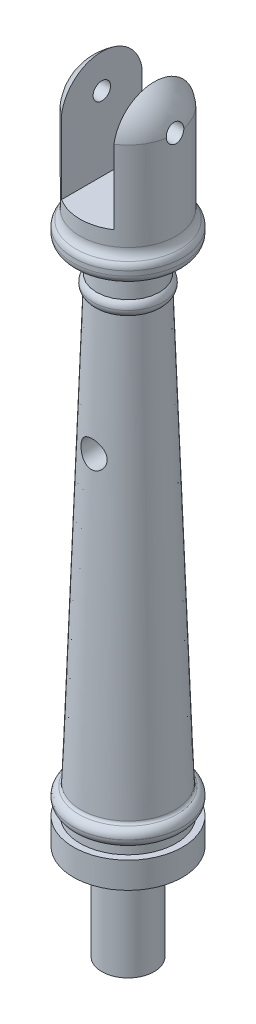
from build123d import *

# Parameters (mm, degrees)
SKETCH3_R               = 12.5
BOSS_EXTRUDE1_DEPTH     = 6
BOSS_EXTRUDE3_START     = -12
SKETCH5_R               = 12.5
BOSS_EXTRUDE3_DEPTH     = 4
FILLET1_R               = 2
SKETCH6_R               = 6
BOSS_EXTRUDE4_DEPTH     = 22
CUT_EXTRUDE1_START      = -15
CUT_EXTRUDE1_DEPTH      = 15
BOSS_EXTRUDE5_START     = -8
SKETCH8_R               = 8
BOSS_EXTRUDE5_DEPTH     = 2
FILLET2_R               = 2
BOSS_EXTRUDE6_START     = 5
SKETCH9_R               = 12.5
BOSS_EXTRUDE6_DEPTH     = 5
SKETCH10_R              = 11
BOSS_EXTRUDE7_DEPTH     = 22
FILLET3_R               = 2
FILLET4_R               = 3
FILLET5_R               = 0.75
CUT_EXTRUDE2_DEPTH      = 152.535125655
CUT_EXTRUDE2_DEPTH_BACK = 152.535125655
SKETCH12_W              = 12
SKETCH12_H              = 28
CUT_EXTRUDE3_DEPTH      = 150.832528731
CUT_EXTRUDE3_DEPTH_BACK = 150.832528731
SKETCH13_R              = 3
CUT_EXTRUDE4_DEPTH      = 150.832528731
CUT_EXTRUDE4_DEPTH_BACK = 150.832528731
SKETCH14_R              = 2


# Some blends are built 0.0001 mm under size
with BuildPart() as part:
    # Sketch2 → Revolve1 (revolve)
    with BuildSketch(Plane.XY, mode=Mode.PRIVATE) as revolve1_sk:
        Polygon((0, 0), (0, 114), (7, 114), (11, 0), align=None)
    revolve(revolve1_sk.sketch.rotate(Axis((0, 0, 0), (0, 1, 0)), 90), axis=Axis((0, 0, 0), (0, 1, 0)))

    # Sketch3 → Boss-Extrude1 (add)
    with BuildSketch(Plane.XZ):
        with Locations(Location((0, 0, 0), (0, 0, 270))):
            Circle(SKETCH3_R)
    extrude(amount=BOSS_EXTRUDE1_DEPTH)

    # Sketch5 → Boss-Extrude3 (add)
    with BuildSketch(Plane.XZ.offset(6).offset(BOSS_EXTRUDE3_START)):
        with Locations(Location((0, 0, 0), (0, 0, 270))):
            Circle(SKETCH5_R)
    extrude(amount=BOSS_EXTRUDE3_DEPTH)

    # Fillet1
    # the kernel refuses this fillet: 2 mm, written as the material it takes off along each edge
    with BuildSketch(Plane(origin=(0, 6, 0), x_dir=(0, 0, -1), z_dir=(-1, 0, 0))) as fillet1_piece_1:
        with BuildLine():
            CenterArc((10.5, 1.97894037), FILLET1_R, 278.322040599, 81.677959401)
            Line((10.789473684, 0), (10.795263158, -0.039578807))
            ThreePointArc((10.795263158, -0.039578807), (11.644736842, -0.04), (12.5, -0.04))
            Line((12.5, -0.04), (12.54, 0))
            Line((12.54, 0), (12.54, 1.97894037))
            Line((12.54, 1.97894037), (12.5, 1.97894037))
        make_face()
    revolve(axis=Axis((0, 6, 0), (0, -1, 0)), mode=Mode.SUBTRACT)
    with BuildSketch(Plane(origin=(0, 2, 0), x_dir=(0, 0, -1), z_dir=(-1, 0, 0))) as fillet1_piece_2:
        with BuildLine():
            CenterArc((10.5, -1.953266712), FILLET1_R, 0, 77.589618941)
            Line((12.5, -1.953266712), (12.54, -1.953266712))
            Line((12.54, -1.953266712), (12.54, 0))
            Line((12.54, 0), (12.5, 0.04))
            ThreePointArc((12.5, 0.04), (11.714912281, 0.04), (10.938421053, 0.039065334))
            Line((10.938421053, 0.039065334), (10.929824561, 0))
        make_face()
    revolve(axis=Axis((0, 2, 0), (0, -1, 0)), mode=Mode.SUBTRACT)

    # Sketch6 → Boss-Extrude4 (add)
    with BuildSketch(Plane.XZ.offset(6)):
        with Locations(Location((0, 0, 0), (0, 0, 270))):
            Circle(SKETCH6_R)
    extrude(amount=BOSS_EXTRUDE4_DEPTH)

    # Sketch7 → Cut-Extrude1 (cut)
    with BuildSketch(Plane.XZ.offset(28).offset(CUT_EXTRUDE1_START)):
        with BuildLine():
            Line((-5, 3.31662479), (-5, -3.31662479))
            ThreePointArc((-5, -3.31662479), (-6, 0), (-5, 3.31662479))
        make_face()
    extrude(amount=CUT_EXTRUDE1_DEPTH, mode=Mode.SUBTRACT)

    # Sketch9 → Boss-Extrude6 (add)
    with BuildSketch(Plane(origin=(0, 114, 0), x_dir=(1, 0, 0), z_dir=(0, 1, 0)).offset(BOSS_EXTRUDE6_START)):
        with Locations(Location((0, 0, 0), (0, 0, 90))):
            Circle(SKETCH9_R)
    extrude(amount=-BOSS_EXTRUDE6_DEPTH)

    # Sketch10 → Boss-Extrude7 (add)
    with BuildSketch(Plane(origin=(0, 119, 0), x_dir=(1, 0, 0), z_dir=(0, 1, 0))):
        with Locations(Location((0, 0, 0), (0, 0, 270))):
            Circle(SKETCH10_R)
    extrude(amount=BOSS_EXTRUDE7_DEPTH)

    # Fillet3
    # the kernel refuses this fillet: 2 mm, written as the material it takes off along each edge
    with BuildSketch(Plane(origin=(0, 114, 0), x_dir=(0, 0, -1), z_dir=(1, 0, 0))) as fillet3_piece_1:
        with BuildLine():
            CenterArc((12.5 - FILLET3_R, FILLET3_R), FILLET3_R, 270, 90)
            Line((12.5 - FILLET3_R, 0), (12.5 - FILLET3_R, -FILLET3_R * 0.02))
            Line((12.5 - FILLET3_R, -FILLET3_R * 0.02), (12.5 + FILLET3_R * 0.02, -FILLET3_R * 0.02))
            Line((12.5 + FILLET3_R * 0.02, -FILLET3_R * 0.02), (12.5 + FILLET3_R * 0.02, FILLET3_R))
            Line((12.5 + FILLET3_R * 0.02, FILLET3_R), (12.5, FILLET3_R))
        make_face()
    revolve(axis=Axis((0, 114, 0), (0, 1, 0)), mode=Mode.SUBTRACT)
    with BuildSketch(Plane(origin=(0, 119, 0), x_dir=(0, 0, -1), z_dir=(1, 0, 0))) as fillet3_piece_2:
        with BuildLine():
            CenterArc((10.5, -1.936491673), FILLET3_R, 0, 75.522487814)
            Line((11, 0), (11.01, 0.038729833))
            ThreePointArc((11.01, 0.038729833), (11.75, 0.04), (12.5, 0.04))
            Line((12.5, 0.04), (12.54, 0))
            Line((12.54, 0), (12.54, -1.936491673))
            Line((12.54, -1.936491673), (12.5, -1.936491673))
        make_face()
    revolve(axis=Axis((0, 119, 0), (0, 1, 0)), mode=Mode.SUBTRACT)

    # Fillet4
    fillet4_edges = [part.edges().sort_by_distance(p)[0] for p in [
        (-11, 119, 0),
    ]]
    fillet(fillet4_edges, radius=FILLET4_R)

    # Fillet5
    fillet5_edges = [part.edges().sort_by_distance(p)[0] for p in [
        (0, 6, 10.789473684),
    ]]
    fillet(fillet5_edges, radius=FILLET5_R)

    # Sketch11 → Revolve2 (revolve)
    with BuildSketch(Plane.XY, mode=Mode.PRIVATE) as revolve2_sk:
        with BuildLine():
            Line((11, 141), (0, 141))
            Line((0, 141), (0, 150.5))
            ThreePointArc((0, 150.5), (7.292505249, 147.825532394), (11, 141))
        make_face()
    revolve(revolve2_sk.sketch.rotate(Axis((0, 141, 0), (0, 1, 0)), 270), axis=Axis((0, 141, 0), (0, 1, 0)))

    # Sketch12 → Cut-Extrude2 (cut, two sides: drawn at the far end of the back side and taken through both)
    with BuildSketch(Plane.XY.offset(-CUT_EXTRUDE2_DEPTH_BACK)):
        with Locations((0, 138)):
            Rectangle(SKETCH12_W, SKETCH12_H)
    extrude(amount=CUT_EXTRUDE2_DEPTH + CUT_EXTRUDE2_DEPTH_BACK, mode=Mode.SUBTRACT)

    # Sketch13 → Cut-Extrude3 (cut, two sides: drawn at the far end of the back side and taken through both)
    with BuildSketch(Plane.XY.offset(-CUT_EXTRUDE3_DEPTH_BACK)):
        with Locations(Location((0, 76, 0), (0, 0, 270.000000009))):
            Circle(SKETCH13_R)
    extrude(amount=CUT_EXTRUDE3_DEPTH + CUT_EXTRUDE3_DEPTH_BACK, mode=Mode.SUBTRACT)

    # Sketch14 → Cut-Extrude4 (cut, two sides: drawn at the far end of the back side and taken through both)
    with BuildSketch(Plane(origin=(0, 0, 0), x_dir=(0, 0, -1), z_dir=(1, 0, 0)).offset(-CUT_EXTRUDE4_DEPTH_BACK)):
        with Locations((0, 141)):
            Circle(SKETCH14_R)
    extrude(amount=CUT_EXTRUDE4_DEPTH + CUT_EXTRUDE4_DEPTH_BACK, mode=Mode.SUBTRACT)


with BuildPart() as body_2:
    # Sketch8 → Boss-Extrude5 (new, symmetric)
    with BuildSketch(Plane(origin=(0, 114, 0), x_dir=(1, 0, 0), z_dir=(0, 1, 0)).offset(BOSS_EXTRUDE5_START)):
        with Locations(Location((0, 0, 0), (0, 0, 270))):
            Circle(SKETCH8_R)
    extrude(amount=BOSS_EXTRUDE5_DEPTH, both=True)

    # Fillet2
    fillet2_edges = [body_2.edges().sort_by_distance(p)[0] for p in [
        (0, 104, -8),
        (0, 108, -8),
    ]]
    fillet(fillet2_edges, radius=FILLET2_R - 0.0001)  # a hair under: the kernel refuses the full size


solid = Compound([part.part, body_2.part])
